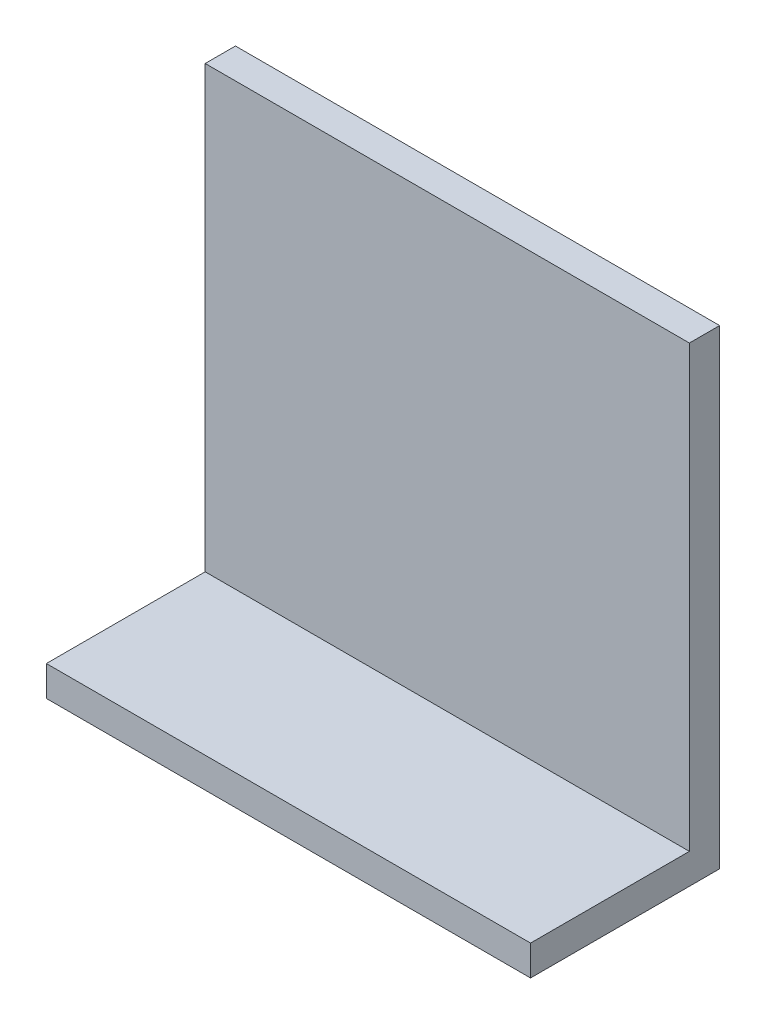
from build123d import *

# Parameters (mm, degrees)
SKETCH1_W           = 32.007575758
SKETCH1_H           = 12.5
BOSS_EXTRUDE1_DEPTH = 2
SKETCH2_W           = 32.007575758
SKETCH2_H           = 29.102375501
BOSS_EXTRUDE2_DEPTH = 2


with BuildPart() as part:
    # Sketch1 → Boss-Extrude1 (new body)
    with BuildSketch(Plane(origin=(0, 0, 0), x_dir=(1, 0, 0), z_dir=(0, 1, 0))):
        with Locations((16.003787879, 6.25)):
            Rectangle(SKETCH1_W, SKETCH1_H)
    extrude(amount=BOSS_EXTRUDE1_DEPTH)

    # Sketch2 → Boss-Extrude2 (add)
    with BuildSketch(Plane(origin=(0, 0, -12.5), x_dir=(-1, 0, 0), z_dir=(0, 0, -1))):
        with Locations((-16.003787879, 16.55118775)):
            Rectangle(SKETCH2_W, SKETCH2_H)
    extrude(amount=-BOSS_EXTRUDE2_DEPTH)


solid = part.part
